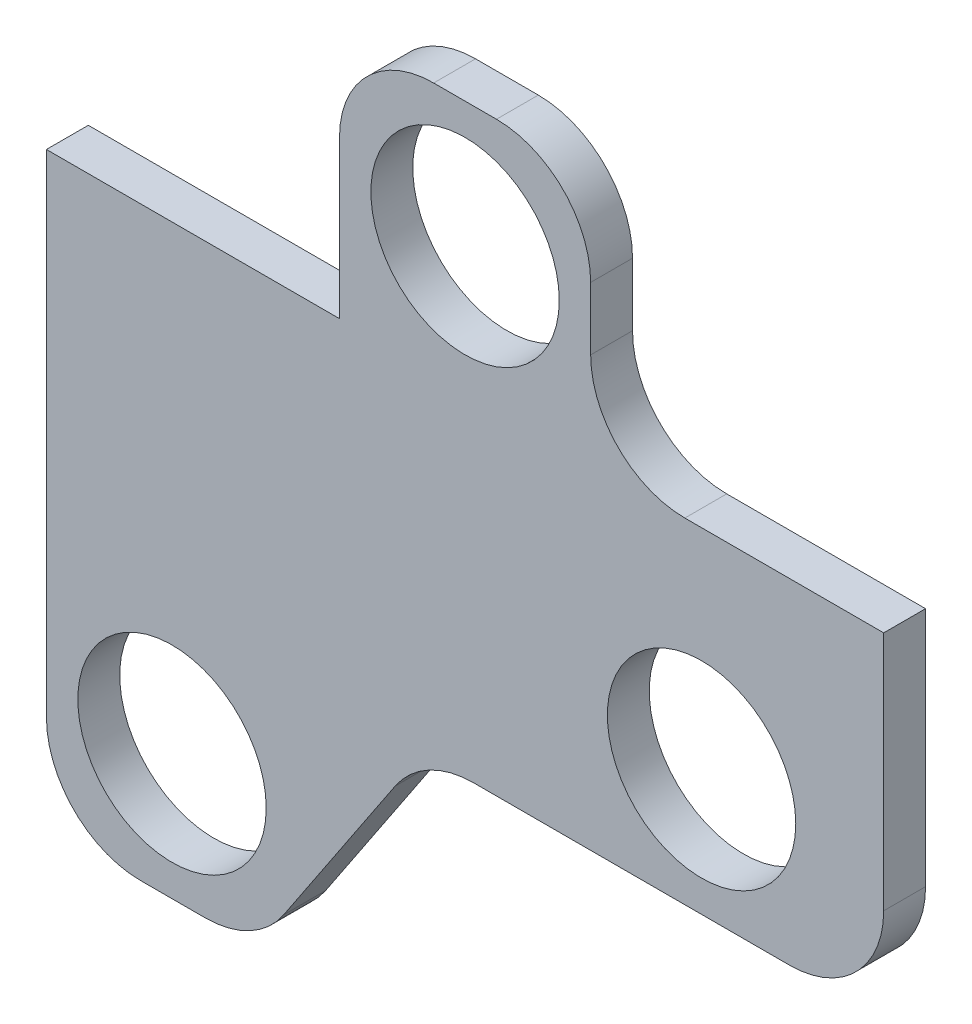
from build123d import *

# Parameters (mm, degrees)
SKETCH1_R           = 14.2875
BOSS_EXTRUDE1_DEPTH = 6.35
FILLET1_R           = 14.2875
SKETCH2_W           = 38.1
SKETCH2_H           = 38.1
BOSS_EXTRUDE2_DEPTH = 6.35
FILLET2_R           = 14.2875
SKETCH3_R           = 14.2875
CUT_EXTRUDE1_DEPTH  = 105.341147205


with BuildPart() as part:
    # Sketch1 → Boss-Extrude1 (new body)
    with BuildSketch(Plane.XY):
        Polygon((-6.35, -6.35), (63.5, -6.35), (63.5, 44.45), (-63.5, 44.45), (-63.5, -44.45), (-31.75, -44.45), align=None)
        with Locations((-44.45, -25.4)):
            Circle(SKETCH1_R, mode=Mode.SUBTRACT)
        with Locations((35.871852568, 12.7)):
            Circle(SKETCH1_R, mode=Mode.SUBTRACT)
    extrude(amount=BOSS_EXTRUDE1_DEPTH)

    # Fillet1
    fillet1_edges = [part.edges().sort_by_distance(p)[0] for p in [
        (63.5, -6.35, 3.175),
        (-6.35, -6.35, 3.175),
        (-31.75, -44.45, 3.175),
        (-63.5, -44.45, 3.175),
    ]]
    fillet(fillet1_edges, radius=FILLET1_R)

    # Sketch2 → Boss-Extrude2 (add)
    with BuildSketch(Plane.XY.offset(6.35)):
        with Locations((0, 63.5)):
            Rectangle(SKETCH2_W, SKETCH2_H)
    extrude(amount=-BOSS_EXTRUDE2_DEPTH)

    # Fillet2
    fillet2_edges = [part.edges().sort_by_distance(p)[0] for p in [
        (-19.05, 82.55, 3.175),
        (19.05, 82.55, 3.175),
        (19.05, 44.45, 3.175),
    ]]
    fillet(fillet2_edges, radius=FILLET2_R)

    # Sketch3 → Cut-Extrude1 (cut, through all)
    with BuildSketch(Plane.XY.offset(6.35)):
        with Locations((0, 63.5)):
            Circle(SKETCH3_R)
    extrude(amount=-CUT_EXTRUDE1_DEPTH, mode=Mode.SUBTRACT)


solid = part.part
